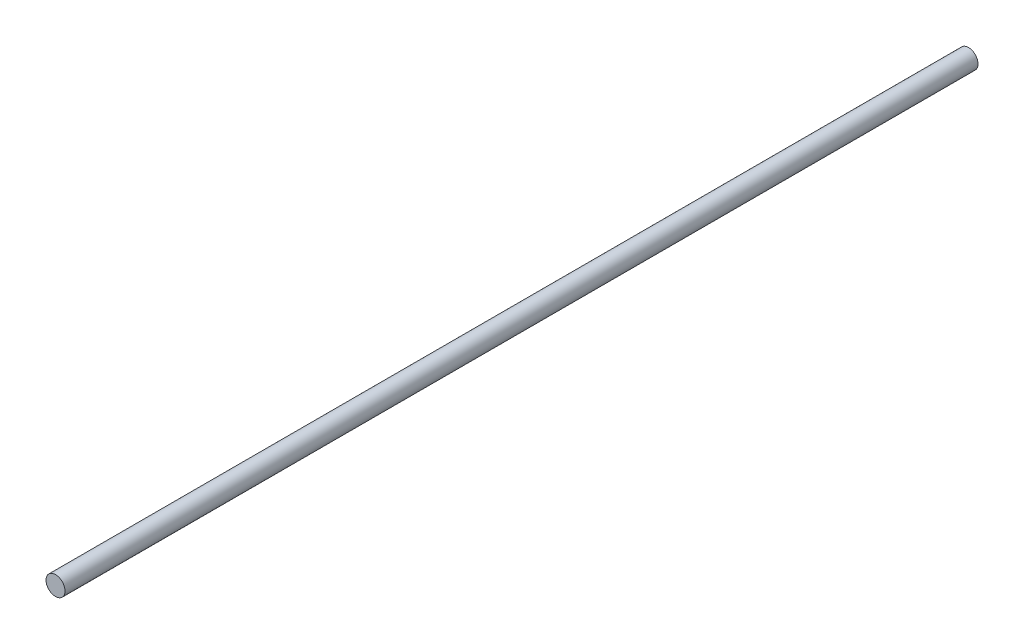
from build123d import *

# Parameters (mm, degrees)
SKETCH1_R           = 6.35
BOSS_EXTRUDE1_DEPTH = 609.6


with BuildPart() as part:
    # Sketch1 → Boss-Extrude1 (new body)
    with BuildSketch(Plane.XY):
        Circle(SKETCH1_R)
    extrude(amount=BOSS_EXTRUDE1_DEPTH)


solid = part.part
